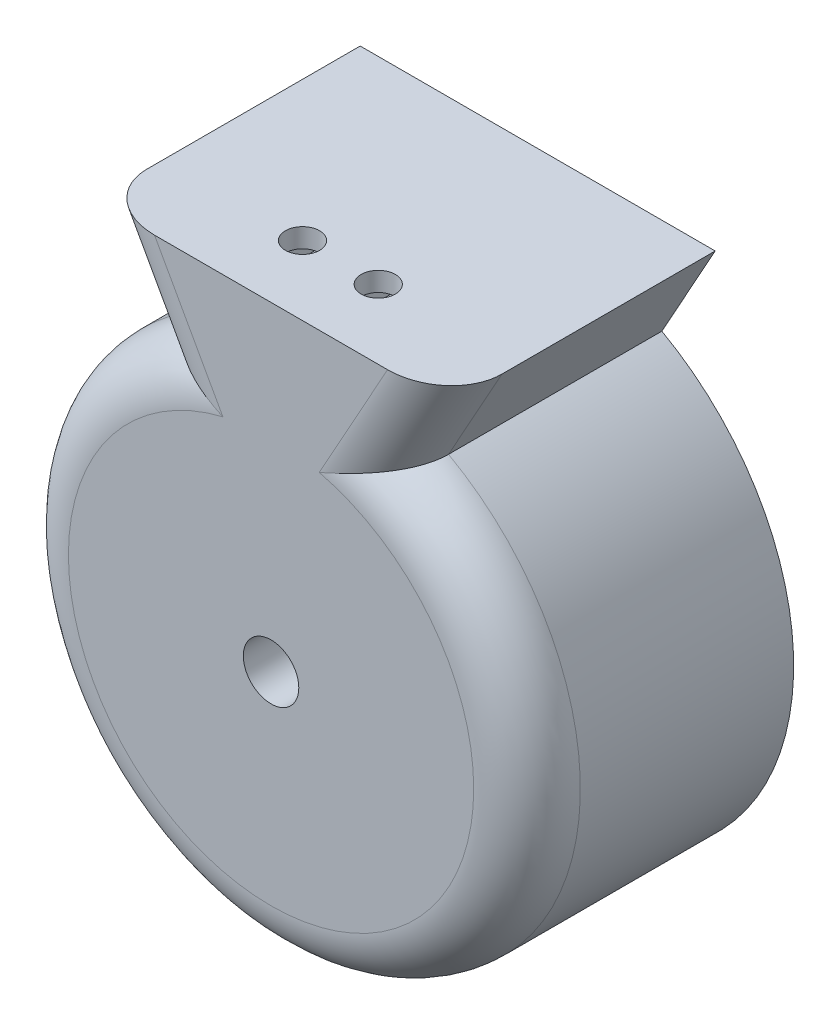
from build123d import *

# Parameters (mm, degrees)
BOSS_EXTRUDE1_DEPTH = 25
FILLET1_R           = 5
SKETCH2_R           = 2.6
CUT_EXTRUDE1_DEPTH  = 46.836666718
SKETCH4_R           = 20
SKETCH4_R_2         = 7.5
CUT_EXTRUDE2_DEPTH  = 21
CUT_EXTRUDE3_START  = 30
SKETCH5_R           = 1.6
CUT_EXTRUDE3_DEPTH  = 6
SKETCH6_W           = 5.6
SKETCH6_H           = 2.4
CUT_EXTRUDE4_DEPTH  = 22.5


with BuildPart() as part:
    # Sketch1 → Boss-Extrude1 (new body)
    with BuildSketch(Plane.XY):
        with BuildLine():
            Line((-16.642519968, 30), (16.642519968, 30))
            Line((16.642519968, 30), (11.642519968, 20.986941864))
            ThreePointArc((11.642519968, 20.986941864), (0, -24), (-11.642519968, 20.986941864))
            Line((-11.642519968, 20.986941864), (-16.642519968, 30))
        make_face()
    extrude(amount=BOSS_EXTRUDE1_DEPTH)

    # Fillet1
    fillet1_edges = [part.edges().sort_by_distance(p)[0] for p in [
        (-14.142519968, 25.493470932, 25),
    ]]
    fillet(fillet1_edges, radius=FILLET1_R)
    fillet1_2_edges = [part.edges().sort_by_distance(p)[0] for p in [
        (14.142519968, 25.493470932, 25),
    ]]
    fillet(fillet1_2_edges, radius=FILLET1_R)
    fillet1_3_edges = [part.edges().sort_by_distance(p)[0] for p in [
        (0, -24, 25),
    ]]
    fillet(fillet1_3_edges, radius=FILLET1_R - 0.0001)  # a hair under: the kernel refuses the full size

    # Sketch2 → Cut-Extrude1 (cut, through all)
    with BuildSketch(Plane.XY):
        Circle(SKETCH2_R)
    extrude(amount=CUT_EXTRUDE1_DEPTH, mode=Mode.SUBTRACT)

    # Sketch4 → Cut-Extrude2 (cut)
    with BuildSketch(Plane.XY):
        with Locations(Location((0, 0, 0), (0, 0, 180))):
            Circle(SKETCH4_R)
        with Locations(Location((0, 0, 0), (0, 0, 180))):
            Circle(SKETCH4_R_2, mode=Mode.SUBTRACT)
    extrude(amount=CUT_EXTRUDE2_DEPTH, mode=Mode.SUBTRACT)

    # Sketch5 → Cut-Extrude3 (cut)
    with BuildSketch(Plane(origin=(0, 0, 0), x_dir=(1, 0, 0), z_dir=(0, 1, 0)).offset(CUT_EXTRUDE3_START)):
        with Locations(Location((-3.55, -18.5, 0), (0, 0, 90))):
            Circle(SKETCH5_R)
        with Locations(Location((3.55, -18.5, 0), (0, 0, 90))):
            Circle(SKETCH5_R)
    extrude(amount=-CUT_EXTRUDE3_DEPTH, mode=Mode.SUBTRACT)

    # Sketch6 → Cut-Extrude4 (cut)
    with BuildSketch(Plane.XY):
        with Locations((3.55, 27)):
            Rectangle(SKETCH6_W, SKETCH6_H)
        with Locations((-3.55, 27)):
            Rectangle(SKETCH6_W, SKETCH6_H)
    extrude(amount=CUT_EXTRUDE4_DEPTH, mode=Mode.SUBTRACT)


solid = part.part
